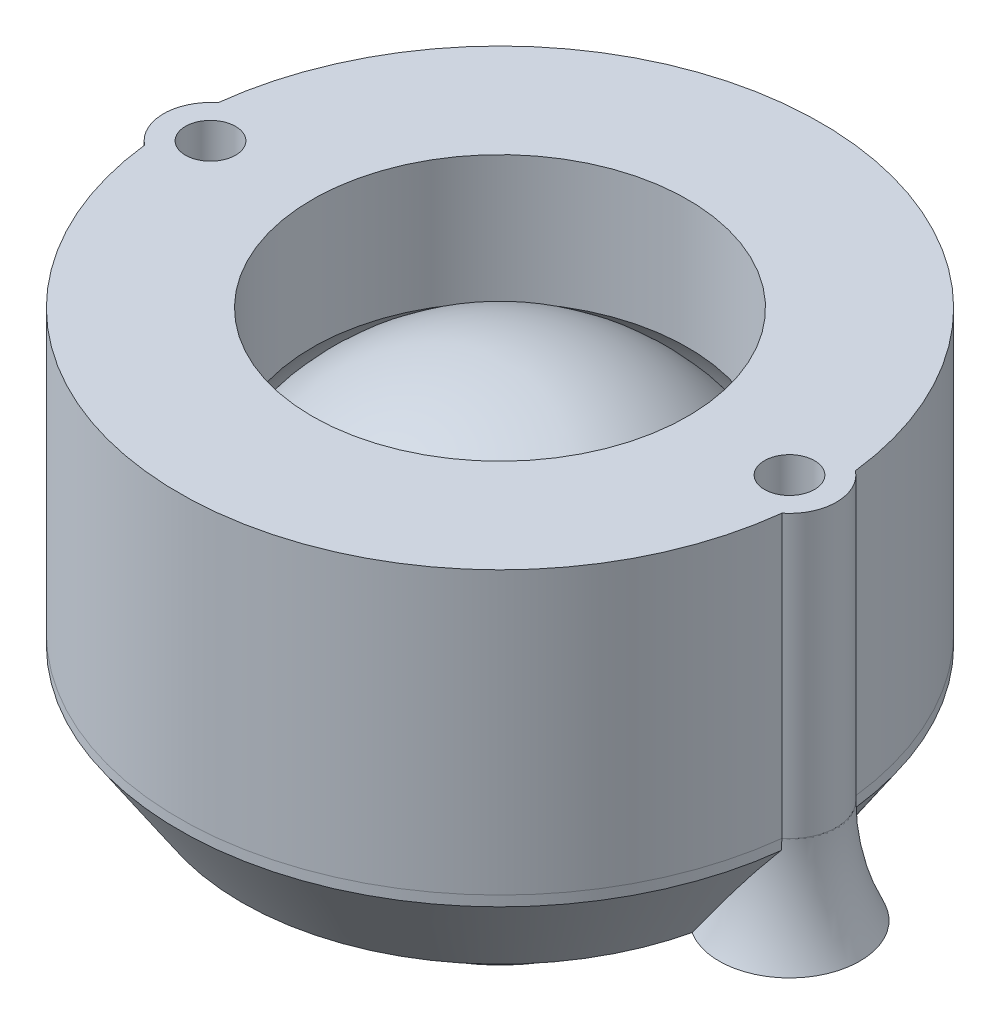
from build123d import *

# Parameters (mm, degrees)
EXTRUDE_START            = -6.652067348
EXTRUDE_3_OUTLINE_R      = 3
EXTRUDE_3_DEPTH          = 3.152067348
SKETCH_4_2_R             = 3
CUT_EXTRUDE_2_DEPTH      = 3.5
EXTRUDE_START_2          = -6.652067
SKETCH_4_3_R             = 3
EXTRUDE_4_DEPTH          = 18
CUT_EXTRUDE_START        = -21.152068
SKETCH_6_R               = 1.3
CUT_EXTRUDE_3_DEPTH      = 24.652068
SKETCH_8_R               = 1.6
CUT_EXTRUDE_4_DEPTH      = 45.401576643
PATTERN_CIRCULAR_1_COUNT = 2


# Read off the part's stored shape, not the designer's step: ﾎﾞｽ - 押し出し3
with BuildPart() as part:
    # ｽｹｯﾁ1 → 回転2 (revolve)
    with BuildSketch(Plane.XY, mode=Mode.PRIVATE) as revolve_2_sk:
        with BuildLine():
            Line((-20.5, 0), (-15.5, 0))
            ThreePointArc((-15.5, 0), (-14.598801321, 5.208166664), (-12, 9.810708435))
            Line((-12, 9.810708435), (-12, 18))
            Line((-12, 18), (-20.5, 18))
            Line((-20.5, 18), (-20.5, 0))
        make_face()
        with BuildLine():
            Line((0, 15), (0, -15))
            ThreePointArc((0, -15), (-15, 0), (0, 15))
        make_face()
    revolve(revolve_2_sk.sketch.rotate(Axis((0, 15, 0), (0, -1, 0)), 270), axis=Axis((0, 15, 0), (0, -1, 0)))

    # ｽｹｯﾁ4<3> → ﾎﾞｽ - 押し出し4 (add)
    with BuildSketch(Plane.XZ.offset(6.652067348).offset(EXTRUDE_START_2)):
        with Locations((18.5, 0)):
            Circle(SKETCH_4_3_R)
        with Locations((-18.5, 0)):
            Circle(SKETCH_4_3_R)
    extrude(amount=-EXTRUDE_4_DEPTH)


with BuildPart() as body_2:
    # ｽｹｯﾁ1<3> → 回転3 (revolve)
    with BuildSketch(Plane.XY, mode=Mode.PRIVATE) as revolve_3_sk:
        with BuildLine():
            Line((-16.5, -6.652067348), (-14, -6.652067348))
            ThreePointArc((-14, -6.652067348), (-15.120350525, -3.409545424), (-15.5, 0))
            Line((-15.5, 0), (-20.5, 0))
            Line((-20.5, 0), (-20.5, -0.652067348))
            Line((-20.5, -0.652067348), (-16.5, -6.652067348))
        make_face()
    revolve(revolve_3_sk.sketch.rotate(Axis((0, 15, 0), (0, -1, 0)), 270), axis=Axis((0, 15, 0), (0, -1, 0)))

    # ﾎﾞｽ - 押し出し3 outline → ﾎﾞｽ - 押し出し3 (add)
    with BuildSketch(Plane.XZ.offset(6.652067348).offset(EXTRUDE_START)):
        with Locations((18.5, 0)):
            Circle(EXTRUDE_3_OUTLINE_R)
        with BuildLine():
            ThreePointArc((-18.593093093, -2.998555265), (-15.5, -1e-09), (-18.593093091, 2.998555265))
            ThreePointArc((-18.593093091, 2.998555265), (-21.5, 1e-09), (-18.593093093, -2.998555265))
        make_face()
    extrude(amount=EXTRUDE_3_DEPTH)

    # ｽｹｯﾁ4<2> → ｶｯﾄ - 押し出し2 (cut)
    with BuildSketch(Plane.XZ.offset(6.652067348)):
        with Locations((18.5, 0)):
            Circle(SKETCH_4_2_R)
        with Locations((-18.5, 0)):
            Circle(SKETCH_4_2_R)
    extrude(amount=-CUT_EXTRUDE_2_DEPTH, mode=Mode.SUBTRACT)


with BuildPart() as cut_extrude_3_tool:
    # ｽｹｯﾁ6 → ｶｯﾄ - 押し出し3 (new body)
    with BuildSketch(Plane.XZ.offset(3.152067348).offset(CUT_EXTRUDE_START)):
        with Locations(Location((18.5, 0, 0), (0, 0, 270))):
            Circle(SKETCH_6_R)
        with Locations(Location((-18.5, 0, 0), (0, 0, 270))):
            Circle(SKETCH_6_R)
    extrude(amount=CUT_EXTRUDE_3_DEPTH)


with BuildPart() as part_1:
    add(part.part)

    # ｶｯﾄ - 押し出し3: cut by cut_extrude_3_tool
    add(cut_extrude_3_tool.part, mode=Mode.SUBTRACT)

    # ｽｹｯﾁ8 → ｶｯﾄ - 押し出し4 (cut, through all)
    with BuildSketch(Plane(origin=(0, 18, 0), x_dir=(1, 0, 0), z_dir=(0, 1, 0))):
        with Locations(Location((18.5, 0, 0), (0, 0, 270))):
            Circle(SKETCH_8_R)
        with Locations(Location((-18.5, 0, 0), (0, 0, 270))):
            Circle(SKETCH_8_R)
    extrude(amount=-CUT_EXTRUDE_4_DEPTH, mode=Mode.SUBTRACT)


with BuildPart() as body_2_1:
    add(body_2.part)

    # ｶｯﾄ - 押し出し3: cut by cut_extrude_3_tool
    add(cut_extrude_3_tool.part, mode=Mode.SUBTRACT)


with BuildPart() as body_3:
    # ｽｹｯﾁ13 → 回転4 (revolve)
    with BuildSketch(Plane.XY, mode=Mode.PRIVATE) as revolve_4_sk:
        with BuildLine():
            Line((-17.25, 0), (-17.25, -6.652067348))
            Line((-17.25, -6.652067348), (-14, -6.652067348))
            ThreePointArc((-14, -6.652067348), (-15.120350525, -3.409545424), (-15.5, 0))
            Line((-15.5, 0), (-17.25, 0))
        make_face()
    revolve(revolve_4_sk.sketch.rotate(Axis((-18.5, 0, 0), (0, -1, 0)), 90), axis=Axis((-18.5, 0, 0), (0, -1, 0)))


with BuildPart() as pattern_circular_1_1:
    # 円形ﾊﾟﾀｰﾝ1: pattern copy
    add(body_3.part.rotate(Axis((0, 0, 0), (0, 1, 0)), 1 * 360 / PATTERN_CIRCULAR_1_COUNT))


solid = Compound([part_1.part, body_2_1.part, body_3.part, pattern_circular_1_1.part])
